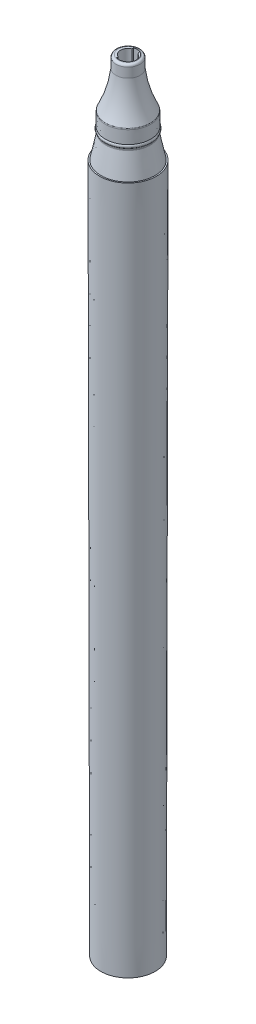
from build123d import *

# Parameters (mm, degrees)
RESSALTO_EXTRUS_O1_DEPTH = 2
CHANFRO1_SIZE            = 0.25


with BuildPart() as part:
    # Esboço1 → Revolução1 (revolve)
    with BuildSketch(Plane.XY, mode=Mode.PRIVATE) as revolu_o1_sk:
        with BuildLine():
            Line((33.39279432927903, 114.70621231461361), (34.28352921645039, 114.70621231461361))
            Line((34.28352921645039, 114.70621231461361), (34.09281492826499, -3.6722014e-10))
            Line((34.09281492826499, -3.6722014e-10), (33.519295524007006, 0.00095355169187072))
            Line((33.519295524007006, 0.00095355169187072), (33.49281603427903, 0.5062123146139103))
            Line((33.49281603427903, 0.5062123146139103), (32.917816034279014, 0.5062123146139103))
            Line((32.917816034279014, 0.5062123146139103), (32.917816034279014, 3.2062123146139183))
            Line((32.917816034279014, 3.2062123146139183), (32.95781603427903, 3.2062123146139183))
            Line((32.95781603427903, 3.2062123146139183), (32.95781603427903, 5.806212314613757))
            Line((32.95781603427903, 5.806212314613757), (32.892816034279015, 5.806212314613757))
            Line((32.892816034279015, 5.806212314613757), (32.892816034279015, 8.506212314613904))
            Line((32.892816034279015, 8.506212314613904), (32.95781603427903, 8.506212314613904))
            Line((32.95781603427903, 8.506212314613904), (32.95781603427903, 11.106212314613757))
            Line((32.95781603427903, 11.106212314613757), (32.892816034279015, 11.106212314613757))
            Line((32.892816034279015, 11.106212314613757), (32.87781603427903, 16.586191785378222))
            Line((32.87781603427903, 16.586191785378222), (32.74281603427903, 114.23621231461357))
            Line((32.74281603427903, 114.23621231461357), (32.77492281544711, 121.91049693796948))
            Line((32.77492281544711, 121.91049693796948), (32.04926108640308, 122.63615866701352))
            ThreePointArc((32.04926108640308, 122.63615866701352), (31.96611615034678, 122.74620729070998), (31.91620182580704, 122.8747854388341))
            add(Edge.make_bspline(
                [(31.067816034260566, 127.90621231498098), (31.159624414103526, 127.03773067057772), (31.39283042587089, 125.33067788015003), (31.72521494180118, 123.68344608647978), (31.91620182580704, 122.8747854388341)],
                knots=[0, 0, 0, 0, 0.48610212271979525, 0.9722042454395905, 0.9722042454395905, 0.9722042454395905, 0.9722042454395905], degree=3))
            Line((31.067816034260566, 127.90621231498098), (31.067816034260566, 129.90621231461355))
            Line((31.067816034260566, 129.90621231461355), (31.177816034260562, 129.90621231461355))
            ThreePointArc((31.177816034260562, 129.90621231461355), (31.46065874673519, 129.78905502708818), (31.577816034260575, 129.50621231461355))
            Line((31.577816034260575, 129.50621231461355), (31.57781603426038, 127.90621231461355))
            ThreePointArc((31.57781603426038, 127.90621231461355), (32.17576220545956, 124.831090217024), (33.29781603426055, 121.90621231461357))
            ThreePointArc((33.29781603426055, 121.90621231461357), (33.31285372452066, 121.80671608363961), (33.31781603426054, 121.70621231461362))
            Line((33.31781603426054, 121.70621231461362), (33.34056266581645, 119.58319336939802))
            ThreePointArc((33.34056266581645, 119.58319336939802), (33.449912976284445, 119.31264051713721), (33.346384664533296, 119.03980682249646))
            ThreePointArc((33.346384664533296, 119.03980682249646), (33.26521415470539, 118.90318171386872), (33.24364865177146, 118.74573330626647))
            ThreePointArc((33.24364865177146, 118.74573330626647), (33.34544118041874, 116.72697780561127), (33.39279432927903, 114.70621231461361))
        make_face()
    revolve(revolu_o1_sk.sketch.rotate(Axis((29.567816034278994, 0.00621231461375715, 0), (0, 1, 0)), 90), axis=Axis((29.567816034278994, 0.00621231461375715, 0), (0, 1, 0)))

    # Esboço3 → Ressalto-extrusão1 (add)
    with BuildSketch(Plane(origin=(9.45e-15, 129.90621231461353, 0), x_dir=(1, -7e-17, 0), z_dir=(7e-17, 1, 0))):
        with BuildLine():
            Line((30.06781603427898, -1.4142135623730947), (30.06781603427898, -1.145643923738959))
            ThreePointArc((30.06781603427898, -1.145643923738959), (30.81781603427898, 6e-17), (30.06781603427898, 1.1456439237389604))
            Line((30.06781603427898, 1.1456439237389604), (30.06781603427898, 1.4142135623730951))
            ThreePointArc((30.06781603427898, 1.4142135623730951), (31.06781603427898, 1.2e-16), (30.06781603427898, -1.4142135623730947))
        make_face()
        with BuildLine():
            Line((29.06781603427898, -1.4142135623730947), (29.06781603427898, -1.145643923738959))
            ThreePointArc((29.06781603427898, -1.145643923738959), (28.31781603427898, -6e-17), (29.06781603427898, 1.1456439237389595))
            Line((29.06781603427898, 1.1456439237389595), (29.06781603427898, 1.4142135623730951))
            ThreePointArc((29.06781603427898, 1.4142135623730951), (28.06781603427898, -3e-17), (29.06781603427898, -1.4142135623730947))
        make_face()
    extrude(amount=-RESSALTO_EXTRUS_O1_DEPTH)

    # Chanfro1
    chanfro1_edges = [part.edges().sort_by_distance(p)[0] for p in [
        (30.81781603427899, 129.90621231461353, -5.6e-16),
    ]]
    chamfer(chanfro1_edges, length=CHANFRO1_SIZE)

    # Chanfro2
    # the kernel refuses this chamfer: 4, 0.779067052 mm, written as the material it adds along each edge
    with BuildSketch(Plane(origin=(29.567816034278994, 114.70621231461361, 0), x_dir=(0, 0, -1), z_dir=(1, 0, 0))) as chanfro2_piece_1:
        with BuildLine():
            Line((3.6487212038849575, 4.113291920261645), (4.530764025903008, -0.15669186754266207))
            Line((4.530764025903008, -0.15669186754266207), (4.530764025903008, -0.23669186754266036))
            ThreePointArc((4.530764025903008, -0.23669186754266036), (4.177871160451517, -0.0799999999999983), (3.824978295000026, -0.0799999999999983))
            Line((3.824978295000026, -0.0799999999999983), (3.7449822575423277, -0.00079623555973285))
            ThreePointArc((3.7449822575423277, -0.00079623555973285), (3.6962925947967897, 2.055128282395245), (3.5688786485986324, 4.1082753113123545))
            Line((3.5688786485986324, 4.1082753113123545), (3.6487212038849575, 4.113291920261645))
        make_face()
    revolve(axis=Axis((29.567816034278994, 114.70621231461361, 0), (0, 1, 0)))


solid = part.part
